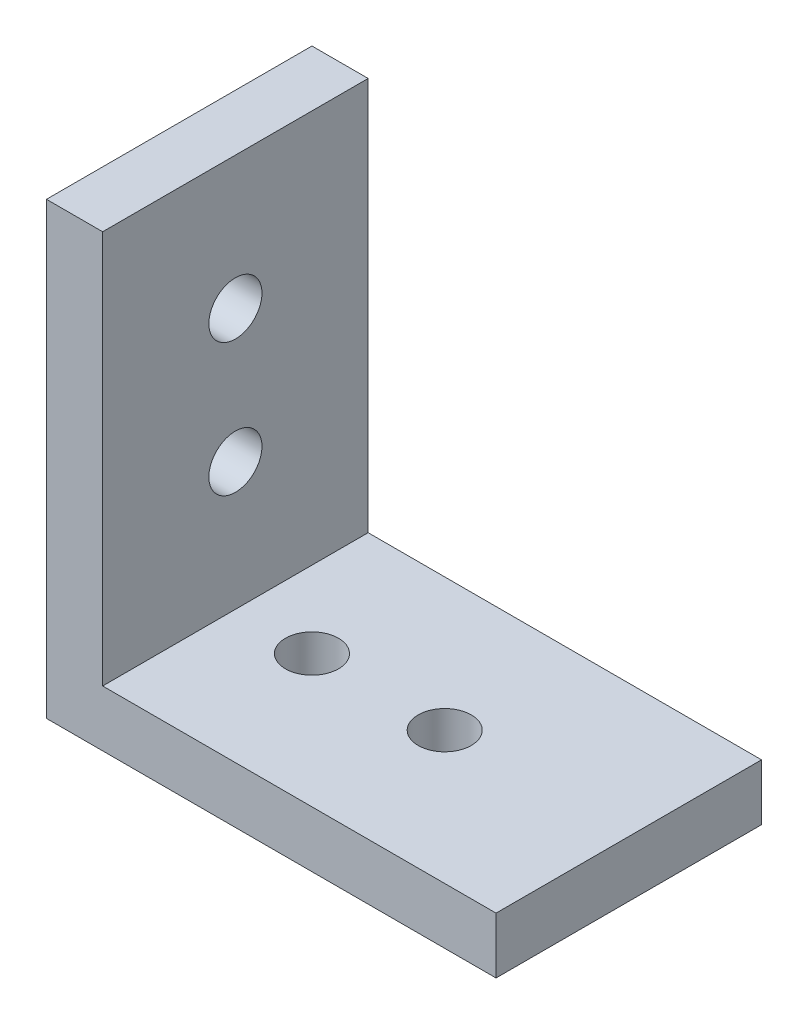
from build123d import *

# Parameters (mm, degrees)
SKETCH1_W           = 15
SKETCH1_H           = 25.4
BOSS_EXTRUDE1_DEPTH = 3.175
SKETCH2_W           = 15
SKETCH2_H           = 3.175
BOSS_EXTRUDE2_DEPTH = 22.225
SKETCH3_R           = 1.5
CUT_EXTRUDE2_DEPTH  = 39.927111375
SKETCH4_R           = 1.5
CUT_EXTRUDE3_DEPTH  = 37.933868265


with BuildPart() as part:
    # Sketch1 → Boss-Extrude1 (new body)
    with BuildSketch(Plane(origin=(0, 0, 0), x_dir=(0, 0, -1), z_dir=(1, 0, 0))):
        with Locations((7.5, 12.7)):
            Rectangle(SKETCH1_W, SKETCH1_H)
    extrude(amount=BOSS_EXTRUDE1_DEPTH)

    # Sketch2 → Boss-Extrude2 (add)
    with BuildSketch(Plane(origin=(3.175, 0, 0), x_dir=(0, 0, -1), z_dir=(1, 0, 0))):
        with Locations((7.5, 1.5875)):
            Rectangle(SKETCH2_W, SKETCH2_H)
    extrude(amount=BOSS_EXTRUDE2_DEPTH)

    # Sketch3 → Cut-Extrude2 (cut, through all)
    with BuildSketch(Plane.XZ):
        with Locations((7.5, -7.5)):
            Circle(SKETCH3_R)
        with Locations((15, -7.5)):
            Circle(SKETCH3_R)
    extrude(amount=-CUT_EXTRUDE2_DEPTH, mode=Mode.SUBTRACT)

    # Sketch4 → Cut-Extrude3 (cut, through all)
    with BuildSketch(Plane(origin=(3.175, 0, 0), x_dir=(0, 0, -1), z_dir=(1, 0, 0))):
        with Locations((7.5, 17.9)):
            Circle(SKETCH4_R)
        with Locations((7.5, 10.4)):
            Circle(SKETCH4_R)
    extrude(amount=-CUT_EXTRUDE3_DEPTH, mode=Mode.SUBTRACT)


solid = part.part
